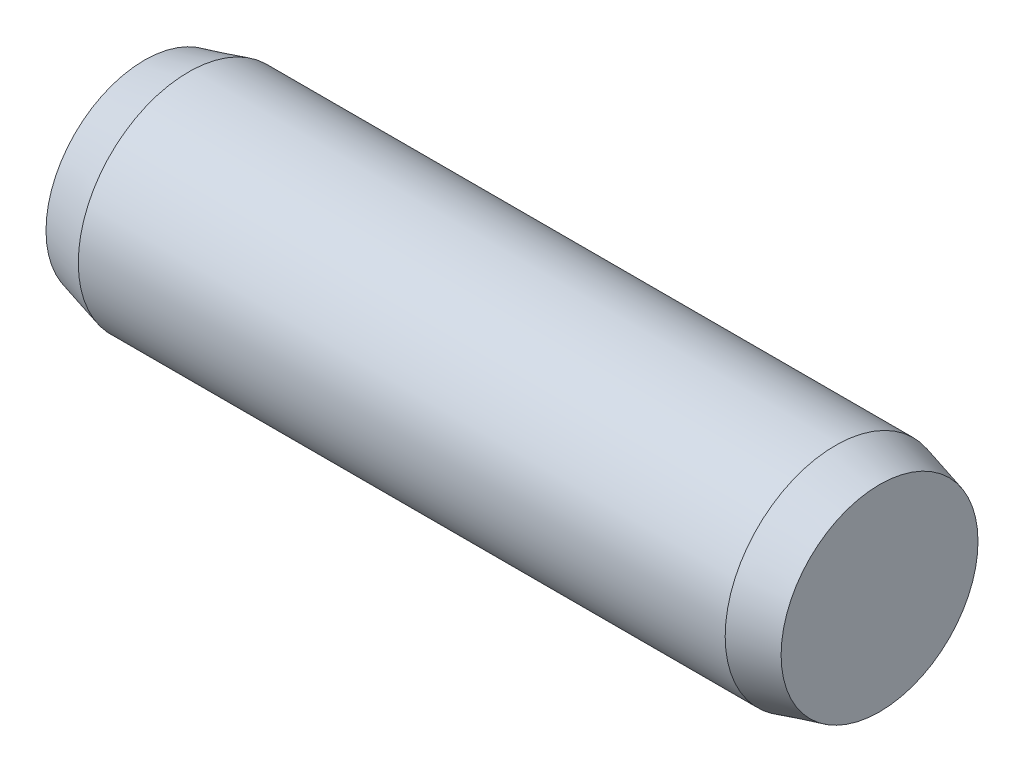
from build123d import *


with BuildPart() as part:
    # Sketch1 → Base-Revolve (revolve)
    with BuildSketch(Plane.XY):
        Polygon((0, 0), (2, 0), (2, 0.267846097), (1.88, 0.3), (0.12, 0.3), (0, 0.267846097), align=None)
    revolve(axis=Axis((-1.655717266, 0, 0), (1, 0, 0)))


solid = part.part
